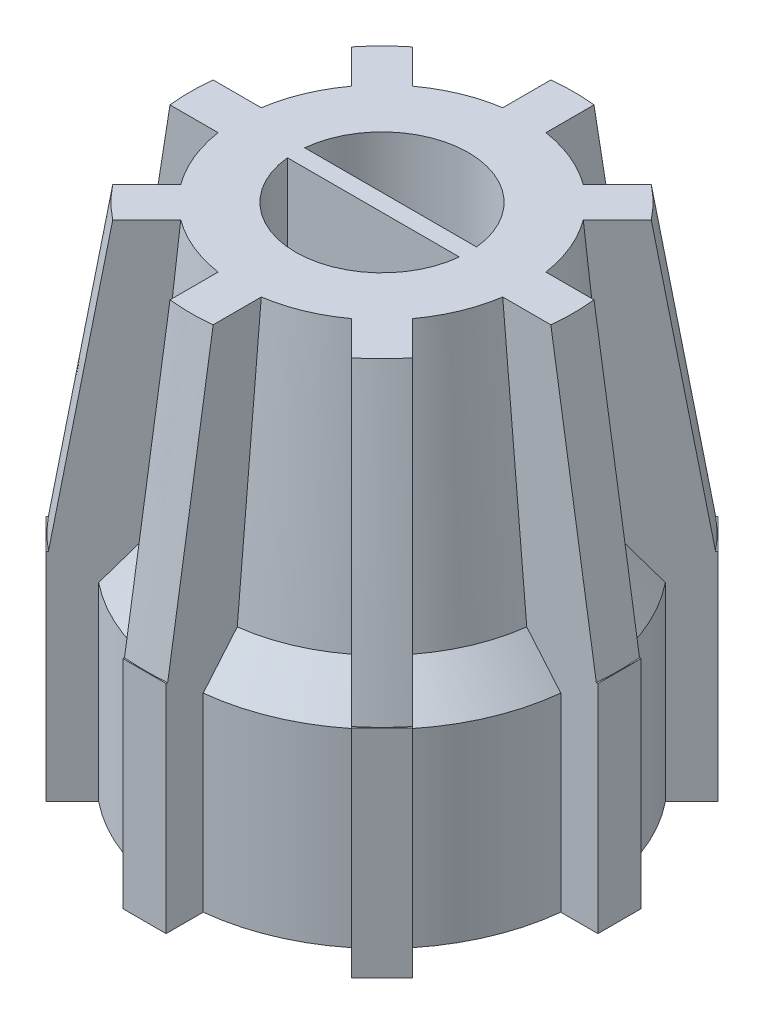
from build123d import *

# Parameters (mm, degrees)
SKETCH1_R           = 8.5
BOSS_EXTRUDE1_DEPTH = 11.5
SKETCH4_R           = 7
SKETCH4_R_2         = 5.5
BOSS_EXTRUDE3_DEPTH = 6
CHAMFER1_SIZE       = 2
CHAMFER1_SIZE_2     = 1.496838609
CHAMFER2_SIZE       = 2
BOSS_EXTRUDE5_REACH = 22.106
CIRPATTERN1_COUNT   = 8
CUT_EXTRUDE1_START  = -4
SKETCH6_R           = 5.5
CUT_EXTRUDE1_DEPTH  = 4


with BuildPart() as part:
    # Sketch1 → Boss-Extrude1 (new body)
    with BuildSketch(Plane(origin=(0, 0, 0), x_dir=(1, 0, 0), z_dir=(0, 1, 0))):
        with Locations(Location((0, 0, 0), (0, 0, 270))):
            Circle(SKETCH1_R)
        with BuildLine():
            Line((-2.984962311, -0.3), (2.984962311, -0.3))
            ThreePointArc((2.984962311, -0.3), (0, -3), (-2.984962311, -0.3))
        make_face(mode=Mode.SUBTRACT)
        with BuildLine():
            Line((-2.984962311, 0.3), (2.984962311, 0.3))
            ThreePointArc((2.984962311, 0.3), (0, 3), (-2.984962311, 0.3))
        make_face(mode=Mode.SUBTRACT)
    extrude(amount=BOSS_EXTRUDE1_DEPTH)

    # Sketch3 → Cut-Revolve1 (revolve, cut)
    with BuildSketch(Plane(origin=(0, 0, 0), x_dir=(0, 0, -1), z_dir=(1, 0, 0)), mode=Mode.PRIVATE) as cut_revolve1_sk:
        Polygon((-8.5, 0), (-8.5, 11.5), (-5, 11.5), (-6, 0), align=None)
        Polygon((5, 11.5), (8.5, 11.5), (8.5, 0), (6, 0), align=None)
    revolve(cut_revolve1_sk.sketch.rotate(Axis((0, 0, 0), (0, 1, 0)), 180), axis=Axis((0, 0, 0), (0, 1, 0)), mode=Mode.SUBTRACT)

    # Sketch4 → Boss-Extrude3 (add)
    with BuildSketch(Plane.XZ):
        with Locations(Location((0, 0, 0), (0, 0, 270))):
            Circle(SKETCH4_R)
        with Locations(Location((0, 0, 0), (0, 0, 270))):
            Circle(SKETCH4_R_2, mode=Mode.SUBTRACT)
    extrude(amount=BOSS_EXTRUDE3_DEPTH)

    # Chamfer1
    # the kernel refuses this chamfer: 2, 1.496838609 mm, written as the material it adds along each edge
    with BuildSketch(Plane(origin=(0, 0, 0), x_dir=(0, 0, -1), z_dir=(1, 0, 0))) as chamfer1_piece_1_section:
        Polygon((6 - CHAMFER1_SIZE * 0.0866296163648, CHAMFER1_SIZE * 0.996240588196), (6 + CHAMFER1_SIZE_2, 0), (6, 0), align=None)
    chamfer1_piece_1 = revolve(axis=Axis((0, 0, 0), (0, 1, 0)), mode=Mode.PRIVATE)
    chamfer1_piece_1 = chamfer1_piece_1 & Plane(origin=(0, 1.298280923, 0), x_dir=(0, 0, -1), z_dir=(0, 1, 0)) * Cylinder(7, 30, mode=Mode.PRIVATE)
    add(chamfer1_piece_1)

    # Chamfer2
    chamfer2_edges = [part.edges().sort_by_distance(p)[0] for p in [
        (0, 0, 5.5),
    ]]
    chamfer(chamfer2_edges, length=CHAMFER2_SIZE)

    # Boss-Extrude5: up to this face of the body (flat: up to its plane)
    boss_extrude5_end = Plane(part.part.faces().sort_by_distance((0, -6, 6.802010101))[0])
    # Sketch5 → Boss-Extrude5 (add, up to the picked face)
    with BuildSketch(Plane(origin=(0, 11.5, 0), x_dir=(1, 0, 0), z_dir=(0, 1, 0)), mode=Mode.PRIVATE) as boss_extrude5_sk1:
        with BuildLine():
            Line((-8.25, 0.75), (-8.25, -0.75))
            Line((-8.25, -0.75), (-4.943429983, -0.75))
            ThreePointArc((-4.943429983, -0.75), (-5, 0), (-4.943429983, 0.75))
            Line((-4.943429983, 0.75), (-8.25, 0.75))
        make_face()
    boss_extrude5_tool1 = split(extrude(boss_extrude5_sk1.sketch, amount=-BOSS_EXTRUDE5_REACH, mode=Mode.PRIVATE), bisect_by=boss_extrude5_end, keep=Keep.BOTH, mode=Mode.PRIVATE)
    # Sketch5 → Boss-Extrude5 (add, up to the picked face)
    with BuildSketch(Plane(origin=(0, 11.5, 0), x_dir=(1, 0, 0), z_dir=(0, 1, 0)), mode=Mode.PRIVATE) as boss_extrude5_sk2:
        with BuildLine():
            ThreePointArc((5, 0), (4.985837438, -0.376065209), (4.943429983, -0.75))
            Line((4.943429983, -0.75), (8.25, -0.75))
            Line((8.25, -0.75), (8.25, 0.75))
            Line((8.25, 0.75), (4.943429983, 0.75))
            ThreePointArc((4.943429983, 0.75), (4.985837438, 0.376065209), (5, 0))
        make_face()
    boss_extrude5_tool2 = split(extrude(boss_extrude5_sk2.sketch, amount=-BOSS_EXTRUDE5_REACH, mode=Mode.PRIVATE), bisect_by=boss_extrude5_end, keep=Keep.BOTH, mode=Mode.PRIVATE)
    boss_extrude5_1 = boss_extrude5_tool1.solids().sort_by(Axis((-6.61555, 11.5, 0), (0, -1, 0)))[0]
    add(boss_extrude5_1)
    boss_extrude5_2 = boss_extrude5_tool2.solids().sort_by(Axis((6.61555, 11.5, 0), (0, -1, 0)))[0]
    add(boss_extrude5_2)
    boss_extrude5 = boss_extrude5_1 + boss_extrude5_2  # Boss-Extrude5 as one shape, for the pattern or mirror that repeats it

    # CirPattern1: Boss-Extrude5 ×8 about axis
    cirpattern1_axis = Axis((0, 0, 0), (0, 1, 0))
    for i in range(1, CIRPATTERN1_COUNT):
        add(boss_extrude5.rotate(cirpattern1_axis, i * 360 / CIRPATTERN1_COUNT))

    # Sketch6 → Cut-Extrude1 (cut)
    with BuildSketch(Plane.XZ.offset(6).offset(CUT_EXTRUDE1_START)):
        with Locations(Location((0, 0, 0), (0, 0, 82.162520237))):
            Circle(SKETCH6_R)
    extrude(amount=CUT_EXTRUDE1_DEPTH, mode=Mode.SUBTRACT)

    # Sketch7 → Cut-Revolve5 (revolve, cut)
    with BuildSketch(Plane(origin=(0, 0, 0), x_dir=(0, 0, -1), z_dir=(1, 0, 0)), mode=Mode.PRIVATE) as cut_revolve5_sk:
        Polygon((-6.657073102, 11.5), (-8.22904743, 1.524772241), (-14.410115385, 1.524772241), (-14.410115385, 11.5), (-8.22904743, 11.5), align=None)
    revolve(cut_revolve5_sk.sketch.rotate(Axis((0, -6, 0), (0, 1, 0)), 187.83747687), axis=Axis((0, -6, 0), (0, 1, 0)), mode=Mode.SUBTRACT)


solid = part.part
